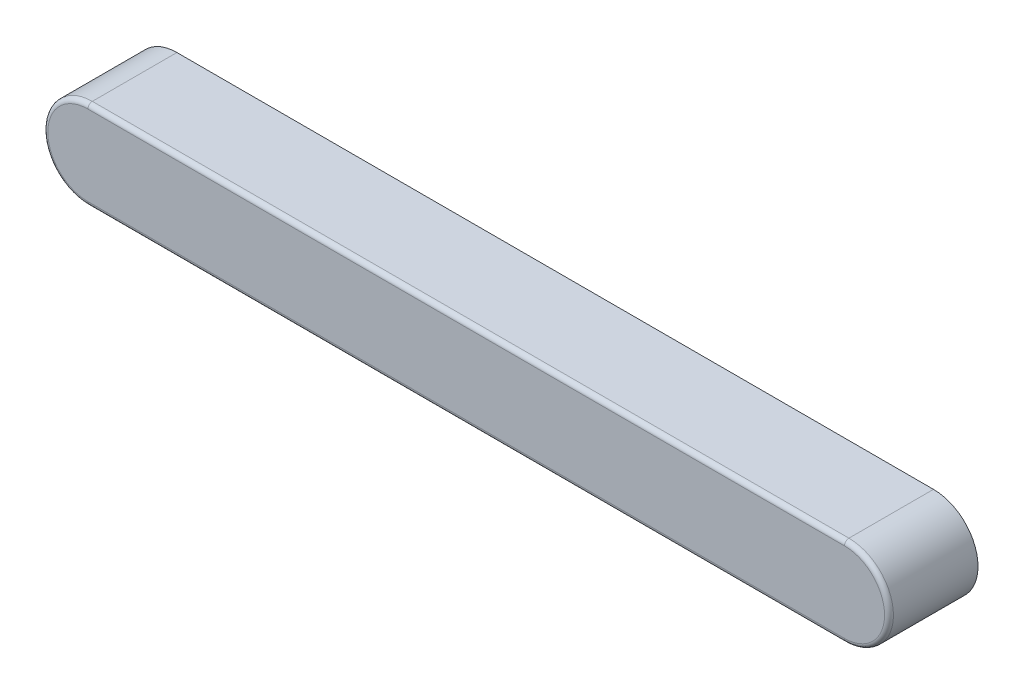
from build123d import *

# Parameters (mm, degrees)
EXTRUDE_1_DEPTH = 2
FILLET_1_R      = 0.1


with BuildPart() as part:
    # 草图1 → 凸台-拉伸1 (new body)
    with BuildSketch(Plane.XY):
        with BuildLine():
            Line((-8.484848485, 5.106060606), (8.515151515, 5.106060606))
            ThreePointArc((8.515151515, 5.106060606), (9.515151515, 4.106060606), (8.515151515, 3.106060606))
            Line((8.515151515, 3.106060606), (-8.484848485, 3.106060606))
            ThreePointArc((-8.484848485, 3.106060606), (-9.484848485, 4.106060606), (-8.484848485, 5.106060606))
        make_face()
    extrude(amount=EXTRUDE_1_DEPTH)

    # 圆角1
    fillet_1_edges = [part.edges().sort_by_distance(p)[0] for p in [
        (0.015151515, 5.106060606, 2),
        (9.515151515, 4.106060606, 2),
        (0.015151515, 3.106060606, 2),
        (-9.484848485, 4.106060606, 2),
    ]]
    fillet(fillet_1_edges, radius=FILLET_1_R)


solid = part.part
